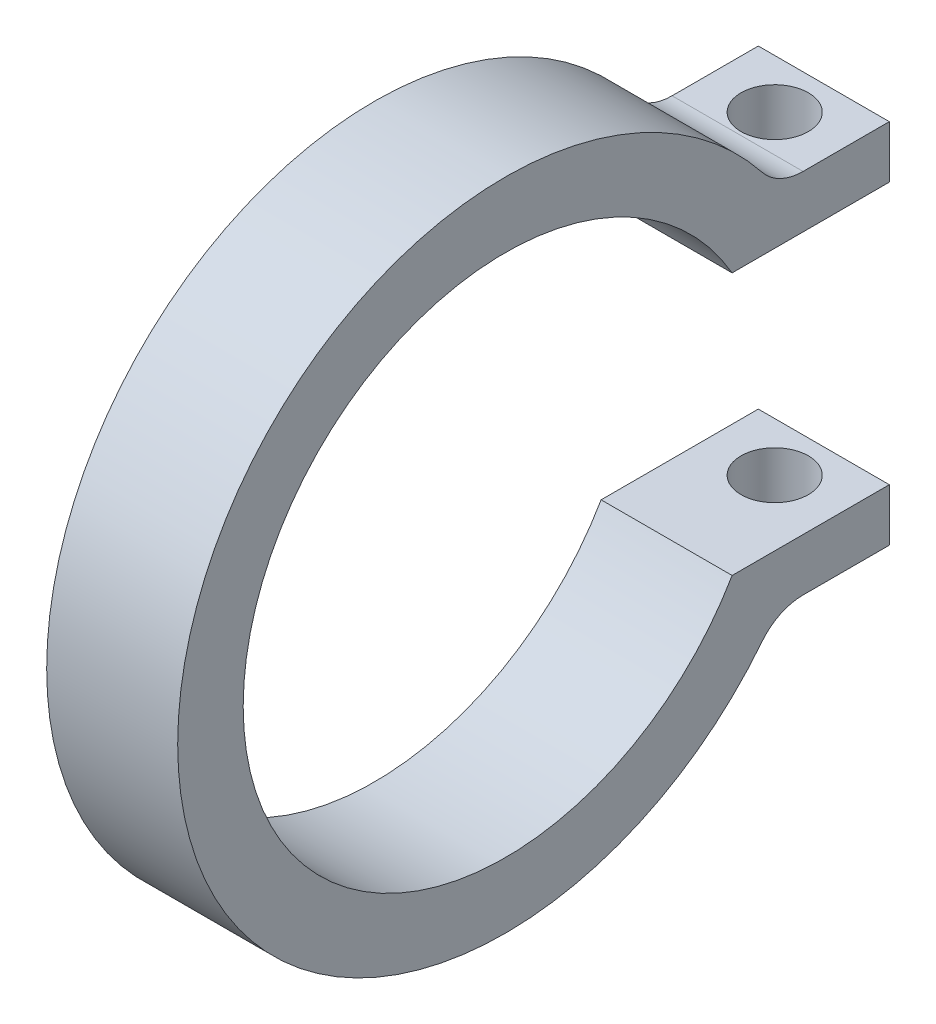
from build123d import *

# Parameters (mm, degrees)
BOSS_EXTRUDE1_DEPTH   = 6.35
F_4_CLEARANCE_HOLE1_D = 3.2639
FILLET2_R             = 2.54


with BuildPart() as part:
    # Sketch2 → Boss-Extrude1 (new body)
    with BuildSketch(Plane.YZ):
        with BuildLine():
            Line((-6.35, -10.998522628), (-6.35, -18.618522628))
            Line((-6.35, -18.618522628), (-8.89, -18.618522628))
            Line((-8.89, -18.618522628), (-8.89, -13.152320138))
            ThreePointArc((-8.89, -13.152320138), (0, 15.875), (8.89, -13.152320138))
            Line((8.89, -13.152320138), (8.89, -18.618522628))
            Line((8.89, -18.618522628), (6.35, -18.618522628))
            Line((6.35, -18.618522628), (6.35, -10.998522628))
            ThreePointArc((6.35, -10.998522628), (0, 12.7), (-6.35, -10.998522628))
        make_face()
    extrude(amount=BOSS_EXTRUDE1_DEPTH)

    # #4 Clearance Hole1 (through all)
    with Locations(Plane.XZ.offset(8.89)):
        with Locations((3.175, -16.237272628)):
            Hole(F_4_CLEARANCE_HOLE1_D / 2)

    # Fillet2
    fillet2_edges = [part.edges().sort_by_distance(p)[0] for p in [
        (3.175, 8.89, -13.152320138),
        (3.175, -8.89, -13.152320138),
    ]]
    fillet(fillet2_edges, radius=FILLET2_R)


solid = part.part
